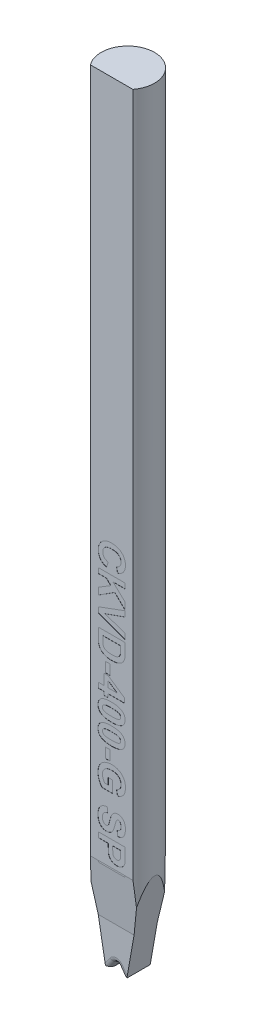
from build123d import *

# Parameters (mm, degrees)
SKETCH_TL_CUTTING_R       = 0.99695
TL_CUTTING_DEPTH          = 29.0068
SKETCH_TDF_GRINDING_W     = 2.0139
SKETCH_TDF_GRINDING_H     = 2.0139
TDF_GRINDING_DEPTH        = 30.041044486
SKETCH_ENGRAVING_W        = 0.166666667
SKETCH_ENGRAVING_H        = 0.371794872
SKETCH_ENGRAVING_W_2      = 1
SKETCH_ENGRAVING_H_2      = 0.192307693
ENGRAVING_DEPTH           = 0.005
VW_VR_GRINDING_DEPTH      = 1.00695
VW_VR_GRINDING_DEPTH_BACK = 1.00695
ISA_GRINDING_DEPTH        = 1.00695
ISA_GRINDING_DEPTH_BACK   = 1.00695
PRE_FRX_BRX_DEPTH         = 1.00695
PRE_FRX_BRX_DEPTH_BACK    = 1.00695
SKETCH_PRE_FRX_BRX_W      = 0.57134
SKETCH_PRE_FRX_BRX_H      = 1.524
FR_EDM_R                  = 0.20066
BR_EDM_R                  = 0.20066
FA_BA_GRINDING_DEPTH      = 1.00695
FA_BA_GRINDING_DEPTH_BACK = 1.00695


with BuildPart() as part:
    # sketch_TL_cutting → TL_cutting (new body)
    with BuildSketch(Plane(origin=(0, 0, 0), x_dir=(1, 0, 0), z_dir=(0, 1, 0))):
        Circle(SKETCH_TL_CUTTING_R)
    extrude(amount=TL_CUTTING_DEPTH)

    # sketch_TDF_grinding → TDF_grinding (cut, through all)
    with BuildSketch(Plane(origin=(0, 0, 0), x_dir=(1, 0, 0), z_dir=(0, 1, 0))):
        with Locations((0, -1.6102)):
            Rectangle(SKETCH_TDF_GRINDING_W, SKETCH_TDF_GRINDING_H)
    extrude(amount=TDF_GRINDING_DEPTH, mode=Mode.SUBTRACT)

    # sketch_engraving → engraving (cut)
    # profile 1 of 17: a face of its own
    with BuildSketch(Plane.XY.offset(0.60325)):
        with BuildLine():
            Line((-0.128205128, 13.263210256), (-0.192307692, 13.070902564))
            add(Edge.make_bspline(
                [(-0.192307692, 13.070902564), (-0.204917923, 13.074809052), (-0.229612721, 13.082459184), (-0.2649877, 13.096537804), (-0.297871332, 13.112532008), (-0.328259475, 13.130359875), (-0.356049464, 13.150095258), (-0.381471598, 13.171589244), (-0.404368127, 13.195053424), (-0.424673345, 13.220470624), (-0.442633936, 13.247563711), (-0.457816548, 13.276656053), (-0.470893242, 13.30731117), (-0.481488041, 13.339840557), (-0.489972889, 13.374028151), (-0.495577171, 13.410034413), (-0.499377062, 13.447690896), (-0.499789062, 13.473403283), (-0.5, 13.486567628)],
                knots=[0, 0, 0, 0, 1.126670901, 2.206376047, 3.246533763, 4.245677351, 5.210506282, 6.152793389, 7.083980095, 8.004497442, 8.926231833, 9.854395169, 10.801995143, 11.768203916, 12.771938831, 13.805609698, 14.87650608, 16, 16, 16, 16], degree=3))
            add(Edge.make_bspline(
                [(-0.5, 13.486567628), (-0.499663994, 13.502816309), (-0.499003061, 13.534777949), (-0.492350465, 13.581519052), (-0.481969511, 13.626060328), (-0.467601869, 13.668469613), (-0.448555271, 13.708448786), (-0.42571373, 13.746373108), (-0.398318662, 13.781809391), (-0.367249987, 13.814950716), (-0.332452821, 13.845079196), (-0.294134751, 13.871072297), (-0.253074131, 13.893610491), (-0.208709772, 13.911536594), (-0.161353037, 13.925621791), (-0.110975156, 13.935468328), (-0.057578507, 13.941634942), (-0.020984357, 13.942337083), (-0.002203526, 13.942697436)],
                knots=[0, 0, 0, 0, 1.025134988, 2.016471176, 2.973446247, 3.909197306, 4.836872559, 5.763618465, 6.698581235, 7.658772073, 8.627106982, 9.597494692, 10.576422683, 11.578339294, 12.6118974, 13.690673505, 14.814808564, 16, 16, 16, 16], degree=3))
            add(Edge.make_bspline(
                [(-0.002203526, 13.942697436), (0.017576475, 13.9423292), (0.056163648, 13.941610839), (0.112313555, 13.935562878), (0.165084042, 13.925516768), (0.214577853, 13.911940058), (0.260470573, 13.893729249), (0.303160692, 13.871873909), (0.342311169, 13.845756152), (0.377833814, 13.815831091), (0.409480853, 13.782697852), (0.437377469, 13.746993428), (0.460593243, 13.708491041), (0.479896446, 13.667667336), (0.494630503, 13.624223397), (0.505304611, 13.578276602), (0.511505561, 13.529806054), (0.512376199, 13.49666808), (0.512820513, 13.479756731)],
                knots=[0, 0, 0, 0, 1.212773307, 2.365899439, 3.458117515, 4.504331001, 5.50806732, 6.480562534, 7.440239902, 8.387651817, 9.323121479, 10.245404239, 11.160468186, 12.07454208, 13.009500751, 13.96802424, 14.963018902, 16, 16, 16, 16], degree=3))
            add(Edge.make_bspline(
                [(0.512820513, 13.479756731), (0.512448361, 13.464987276), (0.511718707, 13.436029796), (0.506761415, 13.393624506), (0.498061698, 13.353436158), (0.486319015, 13.315247521), (0.470821797, 13.279275987), (0.451884357, 13.245457111), (0.429606892, 13.213674651), (0.412205553, 13.194525065), (0.403445513, 13.184884936)],
                knots=[0, 0, 0, 0, 1.098510076, 2.153775193, 3.169777012, 4.153122333, 5.120892526, 6.076995459, 7.031936742, 8, 8, 8, 8], degree=3))
            add(Edge.make_bspline(
                [(0.403445513, 13.184884936), (0.39787141, 13.179297644), (0.386592274, 13.167991818), (0.367549896, 13.152895368), (0.347050772, 13.138582058), (0.324745215, 13.125279068), (0.30046466, 13.113406849), (0.274581981, 13.102394097), (0.246997406, 13.092255069), (0.227800247, 13.086616604), (0.217948718, 13.083723077)],
                knots=[0, 0, 0, 0, 0.885292881, 1.791380647, 2.722937556, 3.69093542, 4.703306561, 5.754477758, 6.847650944, 8, 8, 8, 8], degree=3))
            Line((0.217948718, 13.083723077), (0.179487179, 13.276030769))
            add(Edge.make_bspline(
                [(0.179487179, 13.276030769), (0.1857949, 13.277665288), (0.198219456, 13.280884861), (0.21607256, 13.28739955), (0.233014714, 13.294871208), (0.248625569, 13.3041361), (0.263619506, 13.313962074), (0.277222328, 13.325624773), (0.290109132, 13.338129754), (0.301694454, 13.352018861), (0.312145605, 13.366893589), (0.321339918, 13.382603983), (0.329014435, 13.399188478), (0.335156827, 13.416521754), (0.340319842, 13.434545702), (0.34350638, 13.453432147), (0.345953545, 13.473015752), (0.3460861, 13.486358875), (0.346153846, 13.493178205)],
                knots=[0, 0, 0, 0, 1.051114734, 2.070420253, 3.064047898, 4.034553068, 4.997066449, 5.953344811, 6.921213386, 7.892675544, 8.867420182, 9.852654213, 10.826683617, 11.811917648, 12.818610352, 13.848120519, 14.900229319, 16, 16, 16, 16], degree=3))
            add(Edge.make_bspline(
                [(0.346153846, 13.493178205), (0.345958725, 13.502542256), (0.345576529, 13.52088423), (0.341532101, 13.54761448), (0.335695112, 13.573055692), (0.326982094, 13.59711706), (0.315677399, 13.619731698), (0.302244603, 13.641228905), (0.286035184, 13.661060806), (0.26758257, 13.679699764), (0.246135655, 13.696407721), (0.221779967, 13.711110652), (0.194212535, 13.723304121), (0.163711493, 13.733204409), (0.130202077, 13.740996736), (0.093641969, 13.746561162), (0.054005962, 13.749638434), (0.026581025, 13.750133903), (0.012419872, 13.750389744)],
                knots=[0, 0, 0, 0, 0.93816214, 1.837638998, 2.704791736, 3.551915875, 4.396257554, 5.235807848, 6.087970119, 6.959042444, 7.860386085, 8.80649345, 9.804409709, 10.875695391, 12.017327537, 13.250155505, 14.580089023, 16, 16, 16, 16], degree=3))
            add(Edge.make_bspline(
                [(0.012419872, 13.750389744), (-0.002609028, 13.750136423), (-0.031567402, 13.749648312), (-0.073337178, 13.746571685), (-0.111754322, 13.740971705), (-0.14688701, 13.733282849), (-0.178713725, 13.723332973), (-0.207179389, 13.711159106), (-0.23231734, 13.696686701), (-0.254110839, 13.679938275), (-0.272831387, 13.661337256), (-0.288926796, 13.641387439), (-0.302688307, 13.620206524), (-0.314010391, 13.597667053), (-0.322575422, 13.573683298), (-0.328786932, 13.548452371), (-0.332735688, 13.521881695), (-0.333131326, 13.503675799), (-0.333333333, 13.494380128)],
                knots=[0, 0, 0, 0, 1.475208372, 2.842499301, 4.107722225, 5.282836115, 6.369007568, 7.375918121, 8.315702116, 9.208439171, 10.065831443, 10.90006451, 11.71996243, 12.54067204, 13.369972975, 14.214060185, 15.088124569, 16, 16, 16, 16], degree=3))
            add(Edge.make_bspline(
                [(-0.333333333, 13.494380128), (-0.333161634, 13.487497953), (-0.332824013, 13.473965176), (-0.330681155, 13.453962689), (-0.326591822, 13.43476438), (-0.321184418, 13.416276281), (-0.314399721, 13.398426559), (-0.305696319, 13.38148748), (-0.295693052, 13.365125777), (-0.283969989, 13.34968094), (-0.270808612, 13.334946156), (-0.255597341, 13.321507159), (-0.238701667, 13.309041373), (-0.220008678, 13.297706947), (-0.199678377, 13.28712516), (-0.177394008, 13.278122121), (-0.153515697, 13.269734984), (-0.136789345, 13.265423153), (-0.128205128, 13.263210256)],
                knots=[0, 0, 0, 0, 0.980177776, 1.927374078, 2.859849964, 3.771585772, 4.668674471, 5.574490016, 6.479656464, 7.396337719, 8.332153134, 9.288470092, 10.28125149, 11.318486971, 12.398724812, 13.541284404, 14.738150009, 16, 16, 16, 16], degree=3))
        make_face()
    # profile 2 of 17: a face of its own
    with BuildSketch(Plane.XY.offset(0.60325)):
        Polygon((-0.5, 12.904235897), (0.5, 12.904235897), (0.5, 12.711928205), (0.052283654, 12.711928205), (0.5, 12.290253526), (0.5, 12.026030769), (0.11338141, 12.405838462), (-0.5, 12.013210256), (-0.5, 12.269420192), (-0.035456731, 12.551671795), (-0.198517628, 12.711928205), (-0.5, 12.711928205), align=None)
    # profile 3 of 17: a face of its own
    with BuildSketch(Plane.XY.offset(0.60325)):
        Polygon((-0.5, 11.637008333), (0.5, 12.0068), (0.5, 11.803675), (-0.243589744, 11.538851282), (0.5, 11.275029167), (0.5, 11.070902564), (-0.5, 11.439291987), align=None)
    # profile 4 of 17: a face of its own
    with BuildSketch(Plane.XY.offset(0.60325)):
        with BuildLine():
            Line((0.5, 10.981158974), (0.5, 10.614372115))
            add(Edge.make_bspline(
                [(0.5, 10.614372115), (0.500005193, 10.604354571), (0.500015306, 10.584848084), (0.498840892, 10.556539066), (0.497659587, 10.530066494), (0.495294873, 10.505506352), (0.492816233, 10.482773432), (0.489678088, 10.461826942), (0.485656212, 10.442799202), (0.482484481, 10.430800319), (0.480969551, 10.425069231)],
                knots=[0, 0, 0, 0, 1.259756885, 2.453039283, 3.563158368, 4.591894114, 5.55549294, 6.43918076, 7.254497783, 8, 8, 8, 8], degree=3))
            add(Edge.make_bspline(
                [(0.480969551, 10.425069231), (0.478637325, 10.417900254), (0.474014881, 10.403691431), (0.465827813, 10.382838378), (0.455960096, 10.363004479), (0.445111978, 10.343729819), (0.432903728, 10.325457553), (0.419595761, 10.307742873), (0.404753223, 10.291109803), (0.383633179, 10.26957514), (0.35420815, 10.245150255), (0.315375005, 10.21931972), (0.272594656, 10.197582014), (0.234409605, 10.182390641), (0.20183843, 10.172346542), (0.175754603, 10.165778141), (0.148301213, 10.160106468), (0.119383738, 10.155856292), (0.08913491, 10.152194906), (0.057465542, 10.149567238), (0.024383276, 10.14826625), (0.001870575, 10.147974494), (-0.009615385, 10.147825641)],
                knots=[0, 0, 0, 0, 0.745431882, 1.477436776, 2.212739876, 2.934276521, 3.663147754, 4.384200836, 5.123377481, 5.865761747, 7.365547505, 8.894711587, 10.468722596, 12.101948761, 12.951987285, 13.837595333, 14.760899389, 15.722756883, 16.726861385, 17.773652936, 18.864119771, 20, 20, 20, 20], degree=3))
            add(Edge.make_bspline(
                [(-0.009615385, 10.147825641), (-0.0294616, 10.148217046), (-0.067834928, 10.14897384), (-0.123301552, 10.154571211), (-0.17465514, 10.163866648), (-0.206804138, 10.173577075), (-0.222355769, 10.178274359)],
                knots=[0, 0, 0, 0, 1.103491527, 2.133638164, 3.0971734, 4, 4, 4, 4], degree=3))
            add(Edge.make_bspline(
                [(-0.222355769, 10.178274359), (-0.231274521, 10.181448003), (-0.248819098, 10.187691057), (-0.274127236, 10.198615932), (-0.298211673, 10.210420337), (-0.321053432, 10.223202184), (-0.342549771, 10.237026052), (-0.362636394, 10.251943645), (-0.381577746, 10.267723731), (-0.393236239, 10.27915549), (-0.399038462, 10.284844872)],
                knots=[0, 0, 0, 0, 1.090884612, 2.145940218, 3.175104604, 4.181306866, 5.161203701, 6.118658341, 7.063689906, 8, 8, 8, 8], degree=3))
            add(Edge.make_bspline(
                [(-0.399038462, 10.284844872), (-0.407300305, 10.294131145), (-0.424264154, 10.313198431), (-0.445652736, 10.34654995), (-0.464086504, 10.384425276), (-0.473760833, 10.411739168), (-0.478766026, 10.425870513)],
                knots=[0, 0, 0, 0, 0.912008655, 1.872605891, 2.89935344, 4, 4, 4, 4], degree=3))
            add(Edge.make_bspline(
                [(-0.478766026, 10.425870513), (-0.4805228, 10.431590486), (-0.484168894, 10.443461996), (-0.488062998, 10.462285444), (-0.492165475, 10.482379947), (-0.49463687, 10.503977223), (-0.497243066, 10.526853081), (-0.498706299, 10.551189822), (-0.49974511, 10.576903081), (-0.499913777, 10.594539175), (-0.5, 10.603554808)],
                knots=[0, 0, 0, 0, 0.799129865, 1.658552685, 2.566799617, 3.538529252, 4.561352959, 5.643373779, 6.795284424, 8, 8, 8, 8], degree=3))
            Line((-0.5, 10.603554808), (-0.5, 10.981158974))
            Line((-0.5, 10.981158974), (0.5, 10.981158974))
        make_face()
        with BuildLine():
            Line((0.333333333, 10.788851282), (-0.333333333, 10.788851282))
            Line((-0.333333333, 10.788851282), (-0.333333333, 10.630598077))
            add(Edge.make_bspline(
                [(-0.333333333, 10.630598077), (-0.333276671, 10.62345336), (-0.333167574, 10.609697049), (-0.332847006, 10.589791316), (-0.331979167, 10.571498115), (-0.331080228, 10.554721614), (-0.329595022, 10.53950549), (-0.328134266, 10.525783535), (-0.326090699, 10.513632132), (-0.324477534, 10.506127127), (-0.323717949, 10.502593269)],
                knots=[0, 0, 0, 0, 1.333384787, 2.567275092, 3.714769766, 4.750907381, 5.701951617, 6.567520054, 7.325492842, 8, 8, 8, 8], degree=3))
            add(Edge.make_bspline(
                [(-0.323717949, 10.502593269), (-0.321509316, 10.494316575), (-0.317207482, 10.478195757), (-0.307617456, 10.455560499), (-0.296048139, 10.435078507), (-0.282136533, 10.41640677), (-0.26455548, 10.39957967), (-0.242070693, 10.385215683), (-0.215254411, 10.371922192), (-0.189584523, 10.362818806), (-0.16665678, 10.356284413), (-0.147412959, 10.351861165), (-0.126593091, 10.348365591), (-0.104279343, 10.345358942), (-0.080500412, 10.342929499), (-0.055170426, 10.341417784), (-0.028320392, 10.340386029), (-0.009883527, 10.340219161), (-0.000400641, 10.340133333)],
                knots=[0, 0, 0, 0, 1.038686998, 2.023088296, 2.974059649, 3.888265163, 4.839857954, 5.909819677, 7.113156087, 8.466843969, 9.20827164, 10.006482943, 10.861893492, 11.769681931, 12.739021491, 13.762258324, 14.849031541, 16, 16, 16, 16], degree=3))
            add(Edge.make_bspline(
                [(-0.000400641, 10.340133333), (0.009082275, 10.3402185), (0.027452469, 10.340383485), (0.054102292, 10.341413664), (0.079033415, 10.342916863), (0.102276578, 10.345363691), (0.123864169, 10.348323456), (0.143813574, 10.351860891), (0.161996804, 10.356254423), (0.183589283, 10.362807511), (0.207947697, 10.372644996), (0.23429421, 10.386471199), (0.2571147, 10.402736402), (0.276689574, 10.421091558), (0.29287817, 10.442178569), (0.306422028, 10.465549371), (0.316938162, 10.491680279), (0.321416742, 10.510269318), (0.323717949, 10.519820833)],
                knots=[0, 0, 0, 0, 1.118059345, 2.165891593, 3.144157881, 4.062285166, 4.920717571, 5.712910489, 6.449981617, 7.12489426, 8.371943983, 9.541298068, 10.624898781, 11.666293176, 12.69306237, 13.747704633, 14.842713931, 16, 16, 16, 16], degree=3))
            add(Edge.make_bspline(
                [(0.323717949, 10.519820833), (0.324486218, 10.523955143), (0.326177652, 10.533057311), (0.328151987, 10.548161571), (0.329628909, 10.565948179), (0.331099472, 10.586377116), (0.331977905, 10.609427064), (0.332859431, 10.635132571), (0.333166326, 10.663516851), (0.333276065, 10.683349207), (0.333333333, 10.693699038)],
                knots=[0, 0, 0, 0, 0.578739524, 1.274162912, 2.095457587, 3.035141998, 4.093102578, 5.270121571, 6.575369351, 8, 8, 8, 8], degree=3))
            Line((0.333333333, 10.693699038), (0.333333333, 10.788851282))
        make_face(mode=Mode.SUBTRACT)
    # profile 5 of 17: a face of its own
    with BuildSketch(Plane.XY.offset(0.60325)):
        with Locations((-0.147435898, 9.820902564)):
            Rectangle(SKETCH_ENGRAVING_W, SKETCH_ENGRAVING_H)
    # profile 6 of 17: a face of its own
    with BuildSketch(Plane.XY.offset(0.60325)):
        Polygon((-0.5, 9.199107692), (-0.294871795, 9.199107692), (-0.294871795, 9.59654359), (-0.12880609, 9.59654359), (0.487179487, 9.173666987), (0.487179487, 9.0068), (-0.128205128, 9.0068), (-0.128205128, 8.878594872), (-0.294871795, 8.878594872), (-0.294871795, 9.0068), (-0.5, 9.0068), align=None)
        Polygon((-0.128205128, 9.199107692), (0.204727564, 9.199107692), (-0.128205128, 9.427873718), align=None, mode=Mode.SUBTRACT)
    # profile 7 of 17: a face of its own
    with BuildSketch(Plane.XY.offset(0.60325)):
        with BuildLine():
            add(Edge.make_bspline(
                [(0.5, 8.474748718), (0.49971384, 8.462844998), (0.499156721, 8.439669821), (0.494192381, 8.405907508), (0.486315205, 8.374154925), (0.474936732, 8.344405943), (0.460535804, 8.316509267), (0.442472771, 8.290857415), (0.421624591, 8.26685643), (0.405435577, 8.253000797), (0.397235577, 8.245982692)],
                knots=[0, 0, 0, 0, 1.098626248, 2.138899374, 3.143835643, 4.113754749, 5.073488057, 6.034745239, 7.004566348, 8, 8, 8, 8], degree=3))
            add(Edge.make_bspline(
                [(0.397235577, 8.245982692), (0.392013767, 8.241967993), (0.381356969, 8.233774695), (0.364136726, 8.22274029), (0.345869985, 8.212131685), (0.326116385, 8.202873442), (0.305221356, 8.194000078), (0.283126793, 8.185809313), (0.259707844, 8.17857695), (0.235071142, 8.172272124), (0.209179241, 8.166378627), (0.181968999, 8.161441398), (0.15350924, 8.157215972), (0.123831018, 8.153920738), (0.092992495, 8.150966339), (0.060842825, 8.149349757), (0.027454838, 8.148025267), (0.004742429, 8.147892949), (-0.006810897, 8.147825641)],
                knots=[0, 0, 0, 0, 0.746775751, 1.524038446, 2.317840886, 3.141016509, 3.996283186, 4.892488336, 5.812382473, 6.774967264, 7.776368117, 8.823659909, 9.910833035, 11.039122168, 12.210293276, 13.424012874, 14.68964937, 16, 16, 16, 16], degree=3))
            add(Edge.make_bspline(
                [(-0.006810897, 8.147825641), (-0.01836425, 8.147891934), (-0.041009977, 8.148021876), (-0.074330982, 8.149354693), (-0.106413621, 8.150967781), (-0.13725379, 8.153913853), (-0.166926114, 8.157240728), (-0.195353975, 8.161346272), (-0.22243919, 8.166664764), (-0.248289812, 8.172471418), (-0.27303117, 8.178736077), (-0.296407841, 8.1862899), (-0.318777777, 8.194150303), (-0.339699687, 8.203229898), (-0.359477735, 8.212820372), (-0.377930928, 8.223271112), (-0.395257891, 8.234428726), (-0.40597091, 8.242701289), (-0.411258013, 8.246783974)],
                knots=[0, 0, 0, 0, 1.308411734, 2.564617834, 3.776541518, 4.94597967, 6.0725993, 7.15816376, 8.197872509, 9.197791611, 10.158952087, 11.086962723, 11.979249638, 12.843171697, 13.668427753, 14.467630577, 15.243743175, 16, 16, 16, 16], degree=3))
            add(Edge.make_bspline(
                [(-0.411258013, 8.246783974), (-0.419387722, 8.253737875), (-0.435436162, 8.267465209), (-0.456111536, 8.291200465), (-0.473801555, 8.3168109), (-0.487914093, 8.344657064), (-0.499368982, 8.374261236), (-0.506993451, 8.406065546), (-0.511967929, 8.439735616), (-0.512532265, 8.462911213), (-0.512820513, 8.474748718)],
                knots=[0, 0, 0, 0, 0.991667276, 1.957599061, 2.911530233, 3.873218945, 4.847995157, 5.850445929, 6.902062539, 8, 8, 8, 8], degree=3))
            add(Edge.make_bspline(
                [(-0.512820513, 8.474748718), (-0.512476011, 8.486721133), (-0.511800941, 8.510181702), (-0.506449472, 8.544435149), (-0.497876451, 8.576994622), (-0.485636462, 8.607743234), (-0.469774335, 8.636636989), (-0.45076002, 8.663901616), (-0.427732542, 8.688943948), (-0.40629523, 8.708549361), (-0.386925042, 8.722892741), (-0.37086259, 8.733009036), (-0.353675124, 8.742785358), (-0.33482528, 8.751223499), (-0.314870578, 8.759548475), (-0.293380967, 8.766921787), (-0.270541238, 8.773426959), (-0.246455682, 8.779534901), (-0.220958398, 8.784628025), (-0.194124629, 8.789312952), (-0.165840258, 8.793004927), (-0.136262825, 8.796278243), (-0.105322509, 8.798582844), (-0.073069943, 8.800454475), (-0.039401887, 8.801392969), (-0.01649349, 8.801577608), (-0.004807692, 8.801671795)],
                knots=[0, 0, 0, 0, 1.257818097, 2.464759732, 3.634271214, 4.790227596, 5.933394726, 7.09190477, 8.274482889, 9.50191983, 10.139172818, 10.805000628, 11.49619854, 12.215266328, 12.973768034, 13.768328009, 14.601232062, 15.469317089, 16.379095881, 17.333267023, 18.331755967, 19.376479622, 20.460535752, 21.592206075, 22.771760786, 24, 24, 24, 24], degree=3))
            add(Edge.make_bspline(
                [(-0.004807692, 8.801671795), (0.006678925, 8.801606), (0.02919122, 8.801477052), (0.062378132, 8.800134948), (0.094328674, 8.798541634), (0.12509981, 8.79556902), (0.154640959, 8.792269515), (0.183004063, 8.788156894), (0.209982531, 8.782738814), (0.235876189, 8.777389743), (0.260431507, 8.770649782), (0.2837906, 8.763224475), (0.306110518, 8.755390136), (0.326924245, 8.746217854), (0.346659803, 8.736682898), (0.365109758, 8.726224838), (0.382437536, 8.715069066), (0.39315045, 8.706796265), (0.3984375, 8.702713462)],
                knots=[0, 0, 0, 0, 1.304443357, 2.556541329, 3.771813033, 4.936929721, 6.066661712, 7.147723817, 8.190304831, 9.191350322, 10.149780912, 11.080355239, 11.975107155, 12.834450748, 13.66198663, 14.463397305, 15.241653965, 16, 16, 16, 16], degree=3))
            add(Edge.make_bspline(
                [(0.3984375, 8.702713462), (0.406566428, 8.695759179), (0.422613323, 8.682031089), (0.443299998, 8.658301361), (0.460913987, 8.632719209), (0.475197493, 8.604954301), (0.486497465, 8.575282107), (0.494183265, 8.543436121), (0.499144648, 8.509760686), (0.499710816, 8.486585839), (0.5, 8.474748718)],
                knots=[0, 0, 0, 0, 0.991631672, 1.957528776, 2.911425699, 3.867574088, 4.848108326, 5.850523106, 6.902101959, 8, 8, 8, 8], degree=3))
        make_face()
        with BuildLine():
            add(Edge.make_bspline(
                [(0.333333333, 8.474748718), (0.333068079, 8.480916684), (0.332548986, 8.492987158), (0.328316127, 8.510542094), (0.321759633, 8.527123165), (0.312130705, 8.542681206), (0.299093083, 8.55708978), (0.281476094, 8.569297658), (0.259881539, 8.579851162), (0.243736, 8.585130771), (0.235176282, 8.587929808)],
                knots=[0, 0, 0, 0, 0.909107913, 1.77908945, 2.650019014, 3.530482969, 4.465025013, 5.495890128, 6.672421267, 8, 8, 8, 8], degree=3))
            add(Edge.make_bspline(
                [(0.235176282, 8.587929808), (0.228718042, 8.589677997), (0.214837576, 8.593435317), (0.192206647, 8.59769972), (0.166522939, 8.601216485), (0.137792419, 8.604186038), (0.105999886, 8.606602628), (0.071125109, 8.608090848), (0.033192525, 8.609119478), (0.006878451, 8.609280391), (-0.006810897, 8.609364103)],
                knots=[0, 0, 0, 0, 0.658986521, 1.416336438, 2.266694271, 3.212608458, 4.261595115, 5.407496572, 6.651304179, 8, 8, 8, 8], degree=3))
            add(Edge.make_bspline(
                [(-0.006810897, 8.609364103), (-0.020433943, 8.609373117), (-0.046549094, 8.609390397), (-0.084006477, 8.608216163), (-0.118154033, 8.60704872), (-0.148991056, 8.604679061), (-0.176626244, 8.602340892), (-0.200847568, 8.598803343), (-0.221857789, 8.595250608), (-0.244486895, 8.589217153), (-0.268257705, 8.580901394), (-0.292448985, 8.569672977), (-0.311537375, 8.557007058), (-0.325415776, 8.542475587), (-0.334597404, 8.526730329), (-0.341538269, 8.510426395), (-0.345246665, 8.492874555), (-0.345848983, 8.480840013), (-0.346153846, 8.474748718)],
                knots=[0, 0, 0, 0, 1.613038927, 3.092168624, 4.43749063, 5.658264602, 6.75425577, 7.720394221, 8.556328411, 9.275513998, 10.490872946, 11.534172084, 12.42681833, 13.187531851, 13.88996177, 14.574222125, 15.278341114, 16, 16, 16, 16], degree=3))
            add(Edge.make_bspline(
                [(-0.346153846, 8.474748718), (-0.345874419, 8.46865088), (-0.345321688, 8.456588799), (-0.341225408, 8.439056833), (-0.334465655, 8.422499336), (-0.325029126, 8.406836493), (-0.311901617, 8.39241441), (-0.294300445, 8.380197614), (-0.272700888, 8.36964693), (-0.25655611, 8.364366893), (-0.247996795, 8.361567628)],
                knots=[0, 0, 0, 0, 0.899391665, 1.779078861, 2.640979247, 3.529945348, 4.464599804, 5.495588918, 6.672261578, 8, 8, 8, 8], degree=3))
            add(Edge.make_bspline(
                [(-0.247996795, 8.361567628), (-0.241538043, 8.359821968), (-0.227719754, 8.356087186), (-0.205229709, 8.351792396), (-0.179679092, 8.34826611), (-0.151079269, 8.345324791), (-0.11935541, 8.342884431), (-0.084546407, 8.341408845), (-0.046680798, 8.340379247), (-0.020433482, 8.340217356), (-0.006810897, 8.340133333)],
                knots=[0, 0, 0, 0, 0.66114423, 1.414496391, 2.261103113, 3.210114492, 4.255954433, 5.405607896, 6.653488082, 8, 8, 8, 8], degree=3))
            add(Edge.make_bspline(
                [(-0.006810897, 8.340133333), (0.006810741, 8.340247109), (0.032921137, 8.340465199), (0.070464093, 8.341092091), (0.104645163, 8.342847006), (0.13553417, 8.344603226), (0.163028833, 8.347568631), (0.187277888, 8.350511537), (0.208178651, 8.354583667), (0.23096624, 8.360175697), (0.254848985, 8.36851368), (0.278913284, 8.38008584), (0.298191428, 8.39252291), (0.312146257, 8.407029879), (0.321683592, 8.422748044), (0.328364426, 8.439200374), (0.332523972, 8.456649531), (0.333060584, 8.46864941), (0.333333333, 8.474748718)],
                knots=[0, 0, 0, 0, 1.611458614, 3.088895909, 4.441089836, 5.660086535, 6.747875232, 7.711965119, 8.548505902, 9.26500436, 10.486583113, 11.532259092, 12.419544583, 13.184925779, 13.890764661, 14.581638641, 15.279074115, 16, 16, 16, 16], degree=3))
        make_face(mode=Mode.SUBTRACT)
    # profile 8 of 17: a face of its own
    with BuildSketch(Plane.XY.offset(0.60325)):
        with BuildLine():
            add(Edge.make_bspline(
                [(0.5, 7.705517949), (0.49971384, 7.693614229), (0.499156721, 7.670439051), (0.494192381, 7.636676739), (0.486315205, 7.604924156), (0.474936732, 7.575175173), (0.460535804, 7.547278497), (0.442472771, 7.521626646), (0.421624591, 7.497625661), (0.405435577, 7.483770028), (0.397235577, 7.476751923)],
                knots=[0, 0, 0, 0, 1.098626248, 2.138899374, 3.143835643, 4.113754749, 5.073488057, 6.034745239, 7.004566348, 8, 8, 8, 8], degree=3))
            add(Edge.make_bspline(
                [(0.397235577, 7.476751923), (0.392013767, 7.472737224), (0.381356969, 7.464543926), (0.364136726, 7.45350952), (0.345869985, 7.442900915), (0.326116385, 7.433642673), (0.305221356, 7.424769309), (0.283126793, 7.416578544), (0.259707844, 7.40934618), (0.235071142, 7.403041354), (0.209179241, 7.397147858), (0.181968999, 7.392210628), (0.15350924, 7.387985203), (0.123831018, 7.384689969), (0.092992495, 7.38173557), (0.060842825, 7.380118988), (0.027454838, 7.378794498), (0.004742429, 7.378662179), (-0.006810897, 7.378594872)],
                knots=[0, 0, 0, 0, 0.746775751, 1.524038446, 2.317840886, 3.141016509, 3.996283186, 4.892488336, 5.812382473, 6.774967264, 7.776368117, 8.823659909, 9.910833035, 11.039122168, 12.210293276, 13.424012874, 14.68964937, 16, 16, 16, 16], degree=3))
            add(Edge.make_bspline(
                [(-0.006810897, 7.378594872), (-0.01836425, 7.378661165), (-0.041009977, 7.378791107), (-0.074330982, 7.380123924), (-0.106413621, 7.381737012), (-0.13725379, 7.384683084), (-0.166926114, 7.388009959), (-0.195353975, 7.392115503), (-0.22243919, 7.397433995), (-0.248289812, 7.403240649), (-0.27303117, 7.409505308), (-0.296407841, 7.417059131), (-0.318777777, 7.424919533), (-0.339699687, 7.433999129), (-0.359477735, 7.443589602), (-0.377930928, 7.454040342), (-0.395257891, 7.465197957), (-0.40597091, 7.47347052), (-0.411258013, 7.477553205)],
                knots=[0, 0, 0, 0, 1.308411734, 2.564617834, 3.776541518, 4.94597967, 6.0725993, 7.15816376, 8.197872509, 9.197791611, 10.158952087, 11.086962723, 11.979249638, 12.843171697, 13.668427753, 14.467630577, 15.243743175, 16, 16, 16, 16], degree=3))
            add(Edge.make_bspline(
                [(-0.411258013, 7.477553205), (-0.419387722, 7.484507105), (-0.435436162, 7.49823444), (-0.456111536, 7.521969695), (-0.473801555, 7.547580131), (-0.487914093, 7.575426295), (-0.499368982, 7.605030467), (-0.506993451, 7.636834777), (-0.511967929, 7.670504847), (-0.512532265, 7.693680444), (-0.512820513, 7.705517949)],
                knots=[0, 0, 0, 0, 0.991667276, 1.957599061, 2.911530233, 3.873218945, 4.847995157, 5.850445929, 6.902062539, 8, 8, 8, 8], degree=3))
            add(Edge.make_bspline(
                [(-0.512820513, 7.705517949), (-0.512476011, 7.717490364), (-0.511800941, 7.740950933), (-0.506449472, 7.775204379), (-0.497876451, 7.807763853), (-0.485636462, 7.838512465), (-0.469774335, 7.86740622), (-0.45076002, 7.894670847), (-0.427732542, 7.919713179), (-0.40629523, 7.939318592), (-0.386925042, 7.953661971), (-0.37086259, 7.963778267), (-0.353675124, 7.973554589), (-0.33482528, 7.98199273), (-0.314870578, 7.990317706), (-0.293380967, 7.997691018), (-0.270541238, 8.00419619), (-0.246455682, 8.010304132), (-0.220958398, 8.015397256), (-0.194124629, 8.020082183), (-0.165840258, 8.023774157), (-0.136262825, 8.027047473), (-0.105322509, 8.029352075), (-0.073069943, 8.031223706), (-0.039401887, 8.0321622), (-0.01649349, 8.032346839), (-0.004807692, 8.032441026)],
                knots=[0, 0, 0, 0, 1.257818097, 2.464759732, 3.634271214, 4.790227596, 5.933394726, 7.09190477, 8.274482889, 9.50191983, 10.139172818, 10.805000628, 11.49619854, 12.215266328, 12.973768034, 13.768328009, 14.601232062, 15.469317089, 16.379095881, 17.333267023, 18.331755967, 19.376479622, 20.460535752, 21.592206075, 22.771760786, 24, 24, 24, 24], degree=3))
            add(Edge.make_bspline(
                [(-0.004807692, 8.032441026), (0.006678925, 8.032375231), (0.02919122, 8.032246282), (0.062378132, 8.030904179), (0.094328674, 8.029310865), (0.12509981, 8.026338251), (0.154640959, 8.023038746), (0.183004063, 8.018926125), (0.209982531, 8.013508045), (0.235876189, 8.008158974), (0.260431507, 8.001419013), (0.2837906, 7.993993706), (0.306110518, 7.986159367), (0.326924245, 7.976987084), (0.346659803, 7.967452128), (0.365109758, 7.956994069), (0.382437536, 7.945838297), (0.39315045, 7.937565495), (0.3984375, 7.933482692)],
                knots=[0, 0, 0, 0, 1.304443357, 2.556541329, 3.771813033, 4.936929721, 6.066661712, 7.147723817, 8.190304831, 9.191350322, 10.149780912, 11.080355239, 11.975107155, 12.834450748, 13.66198663, 14.463397305, 15.241653965, 16, 16, 16, 16], degree=3))
            add(Edge.make_bspline(
                [(0.3984375, 7.933482692), (0.406566428, 7.92652841), (0.422613323, 7.91280032), (0.443299998, 7.889070592), (0.460913987, 7.863488439), (0.475197493, 7.835723532), (0.486497465, 7.806051338), (0.494183265, 7.774205352), (0.499144648, 7.740529916), (0.499710816, 7.71735507), (0.5, 7.705517949)],
                knots=[0, 0, 0, 0, 0.991631672, 1.957528776, 2.911425699, 3.867574088, 4.848108326, 5.850523106, 6.902101959, 8, 8, 8, 8], degree=3))
        make_face()
        with BuildLine():
            add(Edge.make_bspline(
                [(0.333333333, 7.705517949), (0.333068079, 7.711685915), (0.332548986, 7.723756389), (0.328316127, 7.741311325), (0.321759633, 7.757892396), (0.312130705, 7.773450436), (0.299093083, 7.787859011), (0.281476094, 7.800066888), (0.259881539, 7.810620392), (0.243736, 7.815900001), (0.235176282, 7.818699038)],
                knots=[0, 0, 0, 0, 0.909107913, 1.77908945, 2.650019014, 3.530482969, 4.465025013, 5.495890128, 6.672421267, 8, 8, 8, 8], degree=3))
            add(Edge.make_bspline(
                [(0.235176282, 7.818699038), (0.228718042, 7.820447227), (0.214837576, 7.824204548), (0.192206647, 7.828468951), (0.166522939, 7.831985716), (0.137792419, 7.834955269), (0.105999886, 7.837371859), (0.071125109, 7.838860078), (0.033192525, 7.839888709), (0.006878451, 7.840049622), (-0.006810897, 7.840133333)],
                knots=[0, 0, 0, 0, 0.658986521, 1.416336438, 2.266694271, 3.212608458, 4.261595115, 5.407496572, 6.651304179, 8, 8, 8, 8], degree=3))
            add(Edge.make_bspline(
                [(-0.006810897, 7.840133333), (-0.020433943, 7.840142347), (-0.046549094, 7.840159627), (-0.084006477, 7.838985394), (-0.118154033, 7.837817951), (-0.148991056, 7.835448292), (-0.176626244, 7.833110123), (-0.200847568, 7.829572574), (-0.221857789, 7.826019839), (-0.244486895, 7.819986384), (-0.268257705, 7.811670625), (-0.292448985, 7.800442207), (-0.311537375, 7.787776289), (-0.325415776, 7.773244818), (-0.334597404, 7.75749956), (-0.341538269, 7.741195625), (-0.345246665, 7.723643786), (-0.345848983, 7.711609244), (-0.346153846, 7.705517949)],
                knots=[0, 0, 0, 0, 1.613038927, 3.092168624, 4.43749063, 5.658264602, 6.75425577, 7.720394221, 8.556328411, 9.275513998, 10.490872946, 11.534172084, 12.42681833, 13.187531851, 13.88996177, 14.574222125, 15.278341114, 16, 16, 16, 16], degree=3))
            add(Edge.make_bspline(
                [(-0.346153846, 7.705517949), (-0.345874419, 7.699420111), (-0.345321688, 7.68735803), (-0.341225408, 7.669826063), (-0.334465655, 7.653268567), (-0.325029126, 7.637605723), (-0.311901617, 7.623183641), (-0.294300445, 7.610966845), (-0.272700888, 7.600416161), (-0.25655611, 7.595136123), (-0.247996795, 7.592336859)],
                knots=[0, 0, 0, 0, 0.899391665, 1.779078861, 2.640979247, 3.529945348, 4.464599804, 5.495588918, 6.672261578, 8, 8, 8, 8], degree=3))
            add(Edge.make_bspline(
                [(-0.247996795, 7.592336859), (-0.241538043, 7.590591199), (-0.227719754, 7.586856417), (-0.205229709, 7.582561627), (-0.179679092, 7.57903534), (-0.151079269, 7.576094022), (-0.11935541, 7.573653662), (-0.084546407, 7.572178076), (-0.046680798, 7.571148478), (-0.020433482, 7.570986587), (-0.006810897, 7.570902564)],
                knots=[0, 0, 0, 0, 0.66114423, 1.414496391, 2.261103113, 3.210114492, 4.255954433, 5.405607896, 6.653488082, 8, 8, 8, 8], degree=3))
            add(Edge.make_bspline(
                [(-0.006810897, 7.570902564), (0.006810741, 7.57101634), (0.032921137, 7.57123443), (0.070464093, 7.571861322), (0.104645163, 7.573616237), (0.13553417, 7.575372457), (0.163028833, 7.578337861), (0.187277888, 7.581280768), (0.208178651, 7.585352897), (0.23096624, 7.590944928), (0.254848985, 7.59928291), (0.278913284, 7.610855071), (0.298191428, 7.623292141), (0.312146257, 7.63779911), (0.321683592, 7.653517274), (0.328364426, 7.669969605), (0.332523972, 7.687418762), (0.333060584, 7.699418641), (0.333333333, 7.705517949)],
                knots=[0, 0, 0, 0, 1.611458614, 3.088895909, 4.441089836, 5.660086535, 6.747875232, 7.711965119, 8.548505902, 9.26500436, 10.486583113, 11.532259092, 12.419544583, 13.184925779, 13.890764661, 14.581638641, 15.279074115, 16, 16, 16, 16], degree=3))
        make_face(mode=Mode.SUBTRACT)
    # profile 9 of 17: a face of its own
    with BuildSketch(Plane.XY.offset(0.60325)):
        with Locations((-0.147435898, 7.051671795)):
            Rectangle(SKETCH_ENGRAVING_W, SKETCH_ENGRAVING_H)
    # profile 10 of 17: a face of its own
    with BuildSketch(Plane.XY.offset(0.60325)):
        with BuildLine():
            Line((-0.128205128, 6.301671795), (0.038461538, 6.301671795))
            Line((0.038461538, 6.301671795), (0.038461538, 5.865774359))
            Line((0.038461538, 5.865774359), (-0.36338141, 5.865774359))
            add(Edge.make_bspline(
                [(-0.36338141, 5.865774359), (-0.368321434, 5.871260375), (-0.378419843, 5.8824749), (-0.392661125, 5.900772664), (-0.406257259, 5.920916779), (-0.4194836, 5.942785469), (-0.432233696, 5.966423992), (-0.444685123, 5.991738064), (-0.45671611, 6.018774391), (-0.471787381, 6.057007711), (-0.488186169, 6.10622183), (-0.502445448, 6.166387076), (-0.511191227, 6.227028267), (-0.512277771, 6.267589075), (-0.512820513, 6.287849679)],
                knots=[0, 0, 0, 0, 0.581799769, 1.189316438, 1.825828404, 2.496525428, 3.203088405, 3.942228803, 4.719818701, 5.534979611, 7.181138583, 8.803804008, 10.403462225, 12, 12, 12, 12], degree=3))
            add(Edge.make_bspline(
                [(-0.512820513, 6.287849679), (-0.512629241, 6.300542166), (-0.512252188, 6.325562831), (-0.509233571, 6.362501118), (-0.504017902, 6.398218224), (-0.496780719, 6.432650736), (-0.487836372, 6.465901646), (-0.476607913, 6.497854166), (-0.463065488, 6.528474068), (-0.447986133, 6.557990581), (-0.430657849, 6.585843177), (-0.411724289, 6.612087023), (-0.390891397, 6.636467404), (-0.36853351, 6.659196217), (-0.344060025, 6.679844803), (-0.318106216, 6.698926641), (-0.290219674, 6.715985038), (-0.260879177, 6.731311559), (-0.230317098, 6.744940942), (-0.198781008, 6.756443246), (-0.166726875, 6.766526922), (-0.134042675, 6.774814707), (-0.10062201, 6.780901654), (-0.066619552, 6.785633529), (-0.031822841, 6.788175004), (-0.008417054, 6.788624325), (0.003405449, 6.788851282)],
                knots=[0, 0, 0, 0, 1.124897971, 2.217508473, 3.282174662, 4.322209414, 5.334422951, 6.332119154, 7.320662553, 8.300074908, 9.267468154, 10.225199689, 11.165658754, 12.107290334, 13.047749399, 14.00069605, 14.959944213, 15.942088746, 16.933021067, 17.923599838, 18.915715637, 19.910475908, 20.909926025, 21.925232038, 22.952013513, 24, 24, 24, 24], degree=3))
            add(Edge.make_bspline(
                [(0.003405449, 6.788851282), (0.016165747, 6.788667383), (0.041321811, 6.788304838), (0.078501182, 6.785175194), (0.114594914, 6.780327239), (0.149519517, 6.772932247), (0.183523729, 6.764078796), (0.216299841, 6.752734109), (0.248180515, 6.739780661), (0.278688999, 6.724496543), (0.308028284, 6.707613971), (0.335510174, 6.6884304), (0.361403632, 6.6676108), (0.385591047, 6.644967968), (0.407627145, 6.620129007), (0.428063784, 6.593603308), (0.447146094, 6.56540846), (0.457908016, 6.545231736), (0.463341346, 6.535045192)],
                knots=[0, 0, 0, 0, 1.105132952, 2.178694671, 3.229818344, 4.257558797, 5.269123684, 6.27148554, 7.259679084, 8.247804916, 9.224967877, 10.189258471, 11.147685264, 12.101072275, 13.055511435, 14.02039165, 15.000562851, 16, 16, 16, 16], degree=3))
            add(Edge.make_bspline(
                [(0.463341346, 6.535045192), (0.467347168, 6.526957841), (0.475455657, 6.510587618), (0.485329628, 6.484514525), (0.494054347, 6.457146948), (0.500719187, 6.428165473), (0.506115234, 6.397878993), (0.510216979, 6.366137917), (0.512307439, 6.332883708), (0.512647258, 6.310221284), (0.512820513, 6.298666987)],
                knots=[0, 0, 0, 0, 0.887950456, 1.797368171, 2.741221183, 3.713797788, 4.722103116, 5.768966405, 6.862521341, 8, 8, 8, 8], degree=3))
            add(Edge.make_bspline(
                [(0.512820513, 6.298666987), (0.512598613, 6.283769487), (0.512167059, 6.254796604), (0.508571106, 6.21255631), (0.502373597, 6.172802674), (0.493837942, 6.135480334), (0.482863355, 6.100669697), (0.469371425, 6.068430687), (0.453633675, 6.038565429), (0.435019378, 6.011506485), (0.414494937, 5.986703918), (0.392035387, 5.964222449), (0.367607461, 5.944053031), (0.341334074, 5.926182318), (0.313106625, 5.910750967), (0.283182558, 5.897482952), (0.251334696, 5.886561769), (0.22921692, 5.881283803), (0.217948718, 5.878594872)],
                knots=[0, 0, 0, 0, 1.271135529, 2.472123572, 3.614091059, 4.701890498, 5.736279567, 6.724681829, 7.680621489, 8.611506429, 9.52200816, 10.424540711, 11.318996785, 12.221421405, 13.131851814, 14.060431888, 15.011860567, 16, 16, 16, 16], degree=3))
            Line((0.217948718, 5.878594872), (0.179487179, 6.070902564))
            add(Edge.make_bspline(
                [(0.179487179, 6.070902564), (0.185798707, 6.072805146), (0.198251232, 6.076558905), (0.216108293, 6.083865481), (0.232994438, 6.092183603), (0.248643132, 6.102010597), (0.263649233, 6.112448251), (0.277161531, 6.124718435), (0.290187329, 6.137625453), (0.301701762, 6.152116609), (0.312086782, 6.167555164), (0.321450083, 6.183776632), (0.329043783, 6.201144974), (0.335153652, 6.219417597), (0.340342569, 6.238505002), (0.343533767, 6.25865634), (0.345940549, 6.2796453), (0.346081986, 6.293985325), (0.346153846, 6.301271154)],
                knots=[0, 0, 0, 0, 1.027780279, 2.027791312, 3.006028774, 3.96000864, 4.908113241, 5.852721087, 6.802883308, 7.765918715, 8.733730415, 9.704005314, 10.683351261, 11.68471758, 12.707948499, 13.764514378, 14.864202456, 16, 16, 16, 16], degree=3))
            add(Edge.make_bspline(
                [(0.346153846, 6.301271154), (0.345859633, 6.312298511), (0.34528545, 6.333819337), (0.341538784, 6.365236876), (0.334873123, 6.394876442), (0.325679114, 6.42281554), (0.313877959, 6.449105391), (0.299029501, 6.473390737), (0.282012344, 6.49627627), (0.262039987, 6.517110747), (0.239645267, 6.53600525), (0.214561065, 6.552361822), (0.186868462, 6.565978599), (0.156706511, 6.577131515), (0.124073954, 6.586011616), (0.088855272, 6.592035764), (0.051104495, 6.595971833), (0.02505068, 6.596349093), (0.01161859, 6.59654359)],
                knots=[0, 0, 0, 0, 1.043810997, 2.037086103, 2.989314757, 3.91471467, 4.817033861, 5.710208705, 6.603920097, 7.511448416, 8.435617211, 9.371747005, 10.338444094, 11.350425613, 12.411431869, 13.5347293, 14.729025275, 16, 16, 16, 16], degree=3))
            add(Edge.make_bspline(
                [(0.01161859, 6.59654359), (-0.002813331, 6.596340916), (-0.03086261, 6.595947007), (-0.071503034, 6.592112106), (-0.109371212, 6.585813885), (-0.14440027, 6.576746527), (-0.176807311, 6.565439264), (-0.206438048, 6.551459735), (-0.233109204, 6.534651899), (-0.256980675, 6.515589064), (-0.278169336, 6.494552253), (-0.296147735, 6.471489293), (-0.31184176, 6.447231086), (-0.32420794, 6.421091286), (-0.33413508, 6.393542798), (-0.341078682, 6.364316769), (-0.345395871, 6.333518498), (-0.345897627, 6.312436945), (-0.346153846, 6.301671795)],
                knots=[0, 0, 0, 0, 1.31821493, 2.562027667, 3.72541598, 4.821825939, 5.863743127, 6.857000185, 7.808227391, 8.737146514, 9.643023621, 10.529087527, 11.404035307, 12.277173472, 13.164790074, 14.074766194, 15.016892606, 16, 16, 16, 16], degree=3))
            add(Edge.make_bspline(
                [(-0.346153846, 6.301671795), (-0.345850315, 6.290768504), (-0.34524035, 6.268857617), (-0.340086045, 6.236036537), (-0.332449955, 6.203036283), (-0.321065283, 6.170643933), (-0.307937779, 6.139257225), (-0.292687307, 6.110091024), (-0.276962331, 6.082698447), (-0.264654274, 6.066185969), (-0.258613782, 6.058082051)],
                knots=[0, 0, 0, 0, 0.993779204, 1.997065276, 3.023588959, 4.078879359, 5.123947549, 6.123456565, 7.079038607, 8, 8, 8, 8], degree=3))
            Line((-0.258613782, 6.058082051), (-0.128205128, 6.058082051))
            Line((-0.128205128, 6.058082051), (-0.128205128, 6.301671795))
        make_face()
    # profile 11 of 17: a face of its own
    with BuildSketch(Plane.XY.offset(0.60325)):
        with BuildLine():
            Line((-0.166666667, 5.340133333), (-0.153846154, 5.147825641))
            add(Edge.make_bspline(
                [(-0.153846154, 5.147825641), (-0.161891279, 5.146292992), (-0.177518424, 5.143315918), (-0.199795017, 5.136712009), (-0.220541784, 5.129405841), (-0.239662803, 5.120792964), (-0.25710555, 5.110927896), (-0.273156714, 5.100137618), (-0.28732832, 5.087894862), (-0.299925293, 5.074563176), (-0.310783278, 5.059989999), (-0.320246275, 5.044289399), (-0.328256178, 5.027368131), (-0.334922245, 5.009290819), (-0.339885492, 4.989877406), (-0.343420115, 4.969309762), (-0.345682646, 4.947554761), (-0.345994208, 4.932687096), (-0.346153846, 4.925069231)],
                knots=[0, 0, 0, 0, 1.20477517, 2.340199137, 3.415898527, 4.440826703, 5.422227366, 6.362763262, 7.28278988, 8.172822029, 9.057410505, 9.952475558, 10.866920142, 11.809098, 12.784128911, 13.811833846, 14.878831738, 16, 16, 16, 16], degree=3))
            add(Edge.make_bspline(
                [(-0.346153846, 4.925069231), (-0.346066367, 4.917050933), (-0.345896216, 4.901454929), (-0.343785338, 4.878854596), (-0.340761278, 4.857722259), (-0.335974263, 4.838244522), (-0.330620744, 4.820057658), (-0.323296559, 4.803613353), (-0.314849171, 4.788645499), (-0.305263574, 4.775192657), (-0.294632459, 4.763452348), (-0.28353392, 4.753181341), (-0.272207737, 4.744235972), (-0.260151301, 4.737195334), (-0.247852227, 4.731497439), (-0.234943611, 4.72773153), (-0.221721863, 4.725187435), (-0.212685699, 4.724895702), (-0.208133013, 4.724748718)],
                knots=[0, 0, 0, 0, 1.417779877, 2.757654889, 4.012140507, 5.189587551, 6.302846416, 7.360586765, 8.365575446, 9.33904572, 10.275781718, 11.161696098, 12.012180333, 12.822428111, 13.625933072, 14.403138519, 15.195454004, 16, 16, 16, 16], degree=3))
            add(Edge.make_bspline(
                [(-0.208133013, 4.724748718), (-0.202439146, 4.725042996), (-0.191320796, 4.725617629), (-0.175220679, 4.729387928), (-0.160658688, 4.736192431), (-0.147071392, 4.745428971), (-0.134926522, 4.758393369), (-0.123459543, 4.774797524), (-0.11316916, 4.795257237), (-0.107424402, 4.810425842), (-0.104366987, 4.818498718)],
                knots=[0, 0, 0, 0, 0.906150226, 1.7694295, 2.610923838, 3.450874087, 4.367551936, 5.419872502, 6.626831617, 8, 8, 8, 8], degree=3))
            add(Edge.make_bspline(
                [(-0.104366987, 4.818498718), (-0.103205903, 4.821962905), (-0.100607587, 4.829715194), (-0.096897182, 4.842941154), (-0.092218385, 4.858926556), (-0.087052561, 4.877819979), (-0.081545375, 4.899582885), (-0.074955523, 4.924008532), (-0.068334023, 4.951467832), (-0.063456004, 4.970680895), (-0.060897436, 4.980758333)],
                knots=[0, 0, 0, 0, 0.521824192, 1.167757792, 1.961731518, 2.901193269, 3.965386864, 5.168422915, 6.514810244, 8, 8, 8, 8], degree=3))
            add(Edge.make_bspline(
                [(-0.060897436, 4.980758333), (-0.0576208, 4.993881849), (-0.051299067, 5.019201528), (-0.040053153, 5.055313187), (-0.028879714, 5.088572685), (-0.016755933, 5.118659788), (-0.004503472, 5.145906368), (0.008737874, 5.169871704), (0.022280434, 5.1910559), (0.032402475, 5.203400422), (0.037259615, 5.209324038)],
                knots=[0, 0, 0, 0, 1.293880989, 2.496331788, 3.617634808, 4.64976062, 5.598842568, 6.473791081, 7.267636666, 8, 8, 8, 8], degree=3))
            add(Edge.make_bspline(
                [(0.037259615, 5.209324038), (0.044137694, 5.216670092), (0.057622804, 5.231072711), (0.079781426, 5.250031522), (0.103188466, 5.265962086), (0.127671148, 5.279074684), (0.153370416, 5.289171137), (0.180114252, 5.296327373), (0.207972454, 5.300959148), (0.22694455, 5.301431789), (0.236578526, 5.301671795)],
                knots=[0, 0, 0, 0, 1.064429417, 2.086912298, 3.078678339, 4.055528992, 5.020032834, 5.993708893, 6.981211098, 8, 8, 8, 8], degree=3))
            add(Edge.make_bspline(
                [(0.236578526, 5.301671795), (0.249044725, 5.301204331), (0.273773943, 5.300277024), (0.310123415, 5.29177467), (0.34519423, 5.27852628), (0.373053378, 5.263173891), (0.394102454, 5.248395366), (0.409316468, 5.236168713), (0.423234984, 5.222478899), (0.436363342, 5.207817469), (0.448421192, 5.191938333), (0.459337354, 5.174821959), (0.469762031, 5.156790204), (0.481724432, 5.130477828), (0.494501972, 5.094946959), (0.505216674, 5.048711911), (0.511620444, 4.998366137), (0.512410831, 4.963416875), (0.512820513, 4.945301603)],
                knots=[0, 0, 0, 0, 1.180224575, 2.341213254, 3.519178081, 4.726056898, 5.344182394, 5.956118988, 6.573855441, 7.192564044, 7.82049682, 8.461345463, 9.116141012, 9.79299132, 11.198532007, 12.687823846, 14.283197644, 16, 16, 16, 16], degree=3))
            add(Edge.make_bspline(
                [(0.512820513, 4.945301603), (0.512622915, 4.930468568), (0.512238592, 4.901618634), (0.508327094, 4.859800661), (0.502300976, 4.820792321), (0.493471523, 4.784657475), (0.482080613, 4.751328087), (0.468307987, 4.720739204), (0.4520288, 4.692971205), (0.433078398, 4.668319232), (0.412189308, 4.646355993), (0.389371716, 4.627196757), (0.364914548, 4.610768024), (0.338835479, 4.596963833), (0.311000478, 4.586123434), (0.281444264, 4.57816159), (0.250236407, 4.572895557), (0.228852471, 4.57157561), (0.217948718, 4.570902564)],
                knots=[0, 0, 0, 0, 1.325136797, 2.577362738, 3.74962816, 4.849499017, 5.896771726, 6.892816139, 7.842473141, 8.766187929, 9.665133525, 10.546015357, 11.42313021, 12.293255665, 13.177485873, 14.086514152, 15.024305989, 16, 16, 16, 16], degree=3))
            Line((0.217948718, 4.570902564), (0.205128205, 4.763210256))
            add(Edge.make_bspline(
                [(0.205128205, 4.763210256), (0.211158714, 4.764319181), (0.22291155, 4.766480361), (0.239739753, 4.771187468), (0.255319488, 4.776468235), (0.269550394, 4.782734545), (0.282452554, 4.789952876), (0.29405422, 4.798157056), (0.304442868, 4.807192928), (0.313348905, 4.817441396), (0.321255295, 4.82866557), (0.327770309, 4.841292058), (0.333732615, 4.854930184), (0.338229411, 4.870091156), (0.341791978, 4.88650001), (0.344434282, 4.904161538), (0.34572413, 4.923113752), (0.346007328, 4.936152118), (0.346153846, 4.942897756)],
                knots=[0, 0, 0, 0, 1.150775252, 2.242741279, 3.277646382, 4.23752694, 5.158201782, 6.048759188, 6.901533576, 7.736611693, 8.592238639, 9.472855288, 10.399741491, 11.383322377, 12.435924598, 13.551250831, 14.733094547, 16, 16, 16, 16], degree=3))
            add(Edge.make_bspline(
                [(0.346153846, 4.942897756), (0.346024502, 4.949911384), (0.345772856, 4.963556709), (0.344228543, 4.983441585), (0.34137789, 5.00209509), (0.337667048, 5.019608838), (0.332618703, 5.035959434), (0.326463073, 5.051112373), (0.319216002, 5.065136981), (0.313514257, 5.073688576), (0.310697115, 5.077913782)],
                knots=[0, 0, 0, 0, 1.186678824, 2.308736671, 3.37120409, 4.377216403, 5.334874112, 6.262130804, 7.141346615, 8, 8, 8, 8], degree=3))
            add(Edge.make_bspline(
                [(0.310697115, 5.077913782), (0.30684882, 5.082749176), (0.299395868, 5.092113832), (0.284596838, 5.102192185), (0.267881777, 5.108259376), (0.256061421, 5.108989631), (0.25, 5.109364103)],
                knots=[0, 0, 0, 0, 1.037857257, 2.010007357, 2.979541333, 4, 4, 4, 4], degree=3))
            add(Edge.make_bspline(
                [(0.25, 5.109364103), (0.244335199, 5.109057853), (0.233176443, 5.108454591), (0.217325189, 5.102369912), (0.202637862, 5.093012505), (0.194659513, 5.084269543), (0.190504808, 5.079716667)],
                knots=[0, 0, 0, 0, 0.98538058, 1.941042925, 2.927803204, 4, 4, 4, 4], degree=3))
            add(Edge.make_bspline(
                [(0.190504808, 5.079716667), (0.187808196, 5.076103373), (0.18178239, 5.068029166), (0.17412302, 5.053238818), (0.165827461, 5.035386481), (0.157717635, 5.014065163), (0.149622864, 4.989416566), (0.141170987, 4.961439191), (0.132605635, 4.93011583), (0.124310512, 4.896244901), (0.116156882, 4.861856369), (0.107242663, 4.82904034), (0.098551989, 4.798526152), (0.089442753, 4.77045529), (0.080574939, 4.744683056), (0.071467056, 4.72133464), (0.062596997, 4.700249725), (0.050400038, 4.675662375), (0.033878763, 4.647795088), (0.009862335, 4.618587027), (-0.017133698, 4.592756224), (-0.042589095, 4.574758007), (-0.064481415, 4.562394174), (-0.081932142, 4.55443317), (-0.100320809, 4.547546277), (-0.119667735, 4.541940365), (-0.140000145, 4.537877428), (-0.161162698, 4.53451511), (-0.183331155, 4.53279724), (-0.198448465, 4.532561042), (-0.206129808, 4.532441026)],
                knots=[0, 0, 0, 0, 0.511875881, 1.143829537, 1.88775736, 2.750598373, 3.734912702, 4.837306479, 6.073130119, 7.42648979, 8.801963576, 10.091065733, 11.292408984, 12.408830014, 13.446061236, 14.39066453, 15.257936293, 16.045629259, 17.510392066, 18.929669597, 20.331293837, 21.746891395, 22.460690638, 23.187651344, 23.925159671, 24.69163991, 25.474819891, 26.281170188, 27.126635539, 28, 28, 28, 28], degree=3))
            add(Edge.make_bspline(
                [(-0.206129808, 4.532441026), (-0.213213723, 4.532606052), (-0.227281693, 4.532933777), (-0.248162112, 4.535224014), (-0.268671734, 4.538765808), (-0.288836268, 4.54400888), (-0.308616053, 4.550964346), (-0.328296541, 4.558795664), (-0.347448635, 4.568588225), (-0.366087841, 4.579733722), (-0.384201522, 4.592026864), (-0.400907086, 4.605960438), (-0.416780552, 4.620701766), (-0.430830184, 4.637206877), (-0.444499814, 4.654290113), (-0.456413626, 4.673066399), (-0.467267368, 4.692934954), (-0.476944445, 4.714076878), (-0.485241283, 4.73656221), (-0.492760445, 4.76025588), (-0.498861937, 4.785381414), (-0.504102567, 4.811768353), (-0.508085093, 4.839519127), (-0.510866581, 4.868597372), (-0.512434986, 4.899010174), (-0.512690407, 4.919725604), (-0.512820513, 4.930277564)],
                knots=[0, 0, 0, 0, 0.900523777, 1.788352984, 2.667658312, 3.544829998, 4.433470602, 5.332071549, 6.235671317, 7.16456001, 8.092361829, 9.015217829, 9.927983376, 10.842405559, 11.767913001, 12.707486241, 13.664840466, 14.644960138, 15.660436429, 16.710285012, 17.80361473, 18.945755434, 20.129541241, 21.366238063, 22.658422763, 24, 24, 24, 24], degree=3))
            add(Edge.make_bspline(
                [(-0.512820513, 4.930277564), (-0.512571769, 4.945512968), (-0.512087459, 4.975176661), (-0.507752501, 5.018272681), (-0.501117535, 5.05869389), (-0.491487967, 5.096374505), (-0.47912575, 5.131360517), (-0.463898318, 5.163636188), (-0.445714308, 5.193044634), (-0.4250161, 5.219952877), (-0.401421388, 5.243992223), (-0.37543806, 5.265637857), (-0.346733609, 5.284470694), (-0.315676999, 5.301000711), (-0.28185988, 5.314489571), (-0.245840091, 5.32601756), (-0.207125792, 5.334594343), (-0.180386288, 5.338255071), (-0.166666667, 5.340133333)],
                knots=[0, 0, 0, 0, 1.217919187, 2.371317543, 3.459749122, 4.490553404, 5.476795534, 6.422548752, 7.338285933, 8.236452553, 9.131296239, 10.026155855, 10.935394819, 11.871650654, 12.834387429, 13.842485342, 14.893012909, 16, 16, 16, 16], degree=3))
        make_face()
    # profile 12 of 17: a face of its own
    with BuildSketch(Plane.XY.offset(0.60325)):
        with BuildLine():
            Line((-0.5, 4.365774359), (0.5, 4.365774359))
            Line((0.5, 4.365774359), (0.5, 4.0458625))
            add(Edge.make_bspline(
                [(0.5, 4.0458625), (0.4999852, 4.031372147), (0.499956962, 4.003724386), (0.499104777, 3.964191754), (0.497929464, 3.928597547), (0.496434625, 3.896930495), (0.494248137, 3.869274026), (0.491629455, 3.845566649), (0.488933209, 3.825699436), (0.486060508, 3.81394182), (0.484775641, 3.808683013)],
                knots=[0, 0, 0, 0, 1.460492613, 2.786636817, 3.985312262, 5.05006335, 5.98179196, 6.7807735, 7.454678796, 8, 8, 8, 8], degree=3))
            add(Edge.make_bspline(
                [(0.484775641, 3.808683013), (0.482781564, 3.801689652), (0.478823789, 3.787809469), (0.470386441, 3.767923495), (0.460608006, 3.748756563), (0.448953875, 3.730549497), (0.435630967, 3.713240356), (0.420747869, 3.696777881), (0.404237636, 3.681073536), (0.386131953, 3.666347457), (0.366525691, 3.652851434), (0.345376234, 3.641220093), (0.322847402, 3.631359617), (0.298873329, 3.623435209), (0.273610941, 3.616883309), (0.246834559, 3.612700716), (0.218752408, 3.609677196), (0.199528035, 3.609469993), (0.189703526, 3.609364103)],
                knots=[0, 0, 0, 0, 0.907183394, 1.800546498, 2.691728384, 3.591410291, 4.495216108, 5.416087871, 6.359626967, 7.337496937, 8.327236581, 9.327316132, 10.346534403, 11.393207653, 12.477041209, 13.600953845, 14.773980723, 16, 16, 16, 16], degree=3))
            add(Edge.make_bspline(
                [(0.189703526, 3.609364103), (0.174784734, 3.609672611), (0.146065241, 3.610266506), (0.104894137, 3.616915955), (0.067280604, 3.62704886), (0.03361575, 3.641889815), (0.003633111, 3.659902901), (-0.023091697, 3.680070707), (-0.046492635, 3.702553937), (-0.066210989, 3.72713317), (-0.082434, 3.753064495), (-0.096247437, 3.779063033), (-0.106871469, 3.805454207), (-0.11149992, 3.823448472), (-0.113782051, 3.832320833)],
                knots=[0, 0, 0, 0, 1.312446177, 2.526530956, 3.662051072, 4.733637382, 5.754065268, 6.735959421, 7.675686778, 8.604015004, 9.502732733, 10.365317746, 11.193993632, 12, 12, 12, 12], degree=3))
            add(Edge.make_bspline(
                [(-0.113782051, 3.832320833), (-0.114986663, 3.838653444), (-0.11752584, 3.852001831), (-0.120056937, 3.873171575), (-0.122858586, 3.896311253), (-0.124685978, 3.921516039), (-0.126397255, 3.948755443), (-0.127205205, 3.978018886), (-0.128178621, 4.00926455), (-0.128196112, 4.030770724), (-0.128205128, 4.04185609)],
                knots=[0, 0, 0, 0, 0.735353946, 1.55003838, 2.431865514, 3.394945452, 4.432993119, 5.54609699, 6.735134699, 8, 8, 8, 8], degree=3))
            Line((-0.128205128, 4.04185609), (-0.128205128, 4.173466667))
            Line((-0.128205128, 4.173466667), (-0.5, 4.173466667))
            Line((-0.5, 4.173466667), (-0.5, 4.365774359))
        make_face()
        with BuildLine():
            Line((0.333333333, 4.173466667), (0.038461538, 4.173466667))
            Line((0.038461538, 4.173466667), (0.038461538, 4.058082051))
            add(Edge.make_bspline(
                [(0.038461538, 4.058082051), (0.038474423, 4.048131925), (0.038499073, 4.029096082), (0.039383856, 4.00178387), (0.040463899, 3.97706083), (0.04225159, 3.954875304), (0.044607724, 3.935361209), (0.047425958, 3.918387865), (0.050450217, 3.903935489), (0.055461898, 3.888307212), (0.063570342, 3.87159746), (0.075224213, 3.853753407), (0.089157789, 3.838077429), (0.105522293, 3.825032937), (0.123704204, 3.814613276), (0.143517189, 3.807152791), (0.164632877, 3.802335563), (0.179260262, 3.801895553), (0.186698718, 3.801671795)],
                knots=[0, 0, 0, 0, 1.411705958, 2.700771114, 3.876961699, 4.922619712, 5.858038221, 6.66485904, 7.363650596, 7.950905807, 8.989198271, 9.987739806, 10.967313358, 11.951275539, 12.944273208, 13.927870418, 14.946261014, 16, 16, 16, 16], degree=3))
            add(Edge.make_bspline(
                [(0.186698718, 3.801671795), (0.195758642, 3.80198671), (0.213324639, 3.802597288), (0.238341551, 3.809330263), (0.261044702, 3.819718473), (0.280727694, 3.834570665), (0.297279472, 3.852511763), (0.31105114, 3.872676808), (0.320688658, 3.895496434), (0.32442284, 3.911646613), (0.326322115, 3.919860897)],
                knots=[0, 0, 0, 0, 1.085904563, 2.105425768, 3.088705091, 4.068969419, 5.045188284, 6.010769642, 6.988240112, 8, 8, 8, 8], degree=3))
            add(Edge.make_bspline(
                [(0.326322115, 3.919860897), (0.326887477, 3.923395692), (0.328142404, 3.931241839), (0.329452077, 3.944283732), (0.330643223, 3.959712293), (0.331621189, 3.977546121), (0.332385732, 3.997714526), (0.333055661, 4.020284032), (0.333109481, 4.0451952), (0.333256648, 4.062622813), (0.333333333, 4.071703846)],
                knots=[0, 0, 0, 0, 0.564603001, 1.253243608, 2.066786758, 3.005752288, 4.070476343, 5.250658742, 6.567396469, 8, 8, 8, 8], degree=3))
            Line((0.333333333, 4.071703846), (0.333333333, 4.173466667))
        make_face(mode=Mode.SUBTRACT)
    # profile 13 of 17: a face of its own
    with BuildSketch(Plane.XY.offset(0.60325)):
        Polygon((-0.5, 3.442697436), (0.5, 3.442697436), (0.5, 2.699107692), (0.333333333, 2.699107692), (0.333333333, 3.250389744), (0.115384615, 3.250389744), (0.115384615, 2.737569231), (-0.051282051, 2.737569231), (-0.051282051, 3.250389744), (-0.333333333, 3.250389744), (-0.333333333, 2.686287179), (-0.5, 2.686287179), align=None)
    # profile 14 of 17: a face of its own
    with BuildSketch(Plane.XY.offset(0.60325)):
        with BuildLine():
            Line((-0.128205128, 1.878594872), (-0.192307692, 1.686287179))
            add(Edge.make_bspline(
                [(-0.192307692, 1.686287179), (-0.204917923, 1.690193667), (-0.229612721, 1.697843799), (-0.2649877, 1.711922419), (-0.297871332, 1.727916624), (-0.328259475, 1.745744491), (-0.356049464, 1.765479873), (-0.381471598, 1.786973859), (-0.404368127, 1.810438039), (-0.424673345, 1.83585524), (-0.442633936, 1.862948327), (-0.457816548, 1.892040669), (-0.470893242, 1.922695786), (-0.481488041, 1.955225172), (-0.489972889, 1.989412767), (-0.495577171, 2.025419029), (-0.499377062, 2.063075511), (-0.499789062, 2.088787899), (-0.5, 2.101952244)],
                knots=[0, 0, 0, 0, 1.126670901, 2.206376047, 3.246533763, 4.245677351, 5.210506282, 6.152793389, 7.083980095, 8.004497442, 8.926231833, 9.854395169, 10.801995143, 11.768203916, 12.771938831, 13.805609698, 14.87650608, 16, 16, 16, 16], degree=3))
            add(Edge.make_bspline(
                [(-0.5, 2.101952244), (-0.499663994, 2.118200924), (-0.499003061, 2.150162564), (-0.492350465, 2.196903667), (-0.481969511, 2.241444943), (-0.467601869, 2.283854229), (-0.448555271, 2.323833401), (-0.42571373, 2.361757723), (-0.398318662, 2.397194006), (-0.367249987, 2.430335331), (-0.332452821, 2.460463811), (-0.294134751, 2.486456912), (-0.253074131, 2.508995107), (-0.208709772, 2.526921209), (-0.161353037, 2.541006406), (-0.110975156, 2.550852944), (-0.057578507, 2.557019557), (-0.020984357, 2.557721699), (-0.002203526, 2.558082051)],
                knots=[0, 0, 0, 0, 1.025134988, 2.016471176, 2.973446247, 3.909197306, 4.836872559, 5.763618465, 6.698581235, 7.658772073, 8.627106982, 9.597494692, 10.576422683, 11.578339294, 12.6118974, 13.690673505, 14.814808564, 16, 16, 16, 16], degree=3))
            add(Edge.make_bspline(
                [(-0.002203526, 2.558082051), (0.017576475, 2.557713815), (0.056163648, 2.556995454), (0.112313555, 2.550947493), (0.165084042, 2.540901384), (0.214577853, 2.527324673), (0.260470573, 2.509113864), (0.303160692, 2.487258524), (0.342311169, 2.461140767), (0.377833814, 2.431215706), (0.409480853, 2.398082467), (0.437377469, 2.362378043), (0.460593243, 2.323875656), (0.479896446, 2.283051952), (0.494630503, 2.239608013), (0.505304611, 2.193661217), (0.511505561, 2.14519067), (0.512376199, 2.112052696), (0.512820513, 2.095141346)],
                knots=[0, 0, 0, 0, 1.212773307, 2.365899439, 3.458117515, 4.504331001, 5.50806732, 6.480562534, 7.440239902, 8.387651817, 9.323121479, 10.245404239, 11.160468186, 12.07454208, 13.009500751, 13.96802424, 14.963018902, 16, 16, 16, 16], degree=3))
            add(Edge.make_bspline(
                [(0.512820513, 2.095141346), (0.512448361, 2.080371892), (0.511718707, 2.051414411), (0.506761415, 2.009009121), (0.498061698, 1.968820773), (0.486319015, 1.930632137), (0.470821797, 1.894660602), (0.451884357, 1.860841727), (0.429606892, 1.829059266), (0.412205553, 1.80990968), (0.403445513, 1.800269551)],
                knots=[0, 0, 0, 0, 1.098510076, 2.153775193, 3.169777012, 4.153122333, 5.120892526, 6.076995459, 7.031936742, 8, 8, 8, 8], degree=3))
            add(Edge.make_bspline(
                [(0.403445513, 1.800269551), (0.39787141, 1.794682259), (0.386592274, 1.783376434), (0.367549896, 1.768279984), (0.347050772, 1.753966673), (0.324745215, 1.740663684), (0.30046466, 1.728791464), (0.274581981, 1.717778712), (0.246997406, 1.707639685), (0.227800247, 1.70200122), (0.217948718, 1.699107692)],
                knots=[0, 0, 0, 0, 0.885292881, 1.791380647, 2.722937556, 3.69093542, 4.703306561, 5.754477758, 6.847650944, 8, 8, 8, 8], degree=3))
            Line((0.217948718, 1.699107692), (0.179487179, 1.891415385))
            add(Edge.make_bspline(
                [(0.179487179, 1.891415385), (0.1857949, 1.893049903), (0.198219456, 1.896269477), (0.21607256, 1.902784165), (0.233014714, 1.910255823), (0.248625569, 1.919520715), (0.263619506, 1.92934669), (0.277222328, 1.941009388), (0.290109132, 1.95351437), (0.301694454, 1.967403477), (0.312145605, 1.982278204), (0.321339918, 1.997988598), (0.329014435, 2.014573093), (0.335156827, 2.03190637), (0.340319842, 2.049930317), (0.34350638, 2.068816762), (0.345953545, 2.088400368), (0.3460861, 2.101743491), (0.346153846, 2.108562821)],
                knots=[0, 0, 0, 0, 1.051114734, 2.070420253, 3.064047898, 4.034553068, 4.997066449, 5.953344811, 6.921213386, 7.892675544, 8.867420182, 9.852654213, 10.826683617, 11.811917648, 12.818610352, 13.848120519, 14.900229319, 16, 16, 16, 16], degree=3))
            add(Edge.make_bspline(
                [(0.346153846, 2.108562821), (0.345958725, 2.117926872), (0.345576529, 2.136268845), (0.341532101, 2.162999095), (0.335695112, 2.188440307), (0.326982094, 2.212501675), (0.315677399, 2.235116313), (0.302244603, 2.256613521), (0.286035184, 2.276445421), (0.26758257, 2.295084379), (0.246135655, 2.311792337), (0.221779967, 2.326495267), (0.194212535, 2.338688736), (0.163711493, 2.348589024), (0.130202077, 2.356381351), (0.093641969, 2.361945777), (0.054005962, 2.365023049), (0.026581025, 2.365518518), (0.012419872, 2.365774359)],
                knots=[0, 0, 0, 0, 0.93816214, 1.837638998, 2.704791736, 3.551915875, 4.396257554, 5.235807848, 6.087970119, 6.959042444, 7.860386085, 8.80649345, 9.804409709, 10.875695391, 12.017327537, 13.250155505, 14.580089023, 16, 16, 16, 16], degree=3))
            add(Edge.make_bspline(
                [(0.012419872, 2.365774359), (-0.002609028, 2.365521038), (-0.031567402, 2.365032928), (-0.073337178, 2.361956301), (-0.111754322, 2.35635632), (-0.14688701, 2.348667464), (-0.178713725, 2.338717589), (-0.207179389, 2.326543722), (-0.23231734, 2.312071317), (-0.254110839, 2.295322891), (-0.272831387, 2.276721872), (-0.288926796, 2.256772054), (-0.302688307, 2.235591139), (-0.314010391, 2.213051668), (-0.322575422, 2.189067913), (-0.328786932, 2.163836986), (-0.332735688, 2.13726631), (-0.333131326, 2.119060415), (-0.333333333, 2.109764744)],
                knots=[0, 0, 0, 0, 1.475208372, 2.842499301, 4.107722225, 5.282836115, 6.369007568, 7.375918121, 8.315702116, 9.208439171, 10.065831443, 10.90006451, 11.71996243, 12.54067204, 13.369972975, 14.214060185, 15.088124569, 16, 16, 16, 16], degree=3))
            add(Edge.make_bspline(
                [(-0.333333333, 2.109764744), (-0.333161634, 2.102882568), (-0.332824013, 2.089349791), (-0.330681155, 2.069347304), (-0.326591822, 2.050148996), (-0.321184418, 2.031660896), (-0.314399721, 2.013811174), (-0.305696319, 1.996872096), (-0.295693052, 1.980510392), (-0.283969989, 1.965065555), (-0.270808612, 1.950330772), (-0.255597341, 1.936891774), (-0.238701667, 1.924425989), (-0.220008678, 1.913091562), (-0.199678377, 1.902509775), (-0.177394008, 1.893506737), (-0.153515697, 1.8851196), (-0.136789345, 1.880807769), (-0.128205128, 1.878594872)],
                knots=[0, 0, 0, 0, 0.980177776, 1.927374078, 2.859849964, 3.771585772, 4.668674471, 5.574490016, 6.479656464, 7.396337719, 8.332153134, 9.288470092, 10.28125149, 11.318486971, 12.398724812, 13.541284404, 14.738150009, 16, 16, 16, 16], degree=3))
        make_face()
    # profile 15 of 17: a face of its own
    with BuildSketch(Plane.XY.offset(0.60325)):
        with Locations((0, 1.43628718)):
            Rectangle(SKETCH_ENGRAVING_W_2, SKETCH_ENGRAVING_H_2)
    # profile 16 of 17: a face of its own
    with BuildSketch(Plane.XY.offset(0.60325)):
        Polygon((-0.5, 0.276030769), (-0.5, 0.479957051), (-0.269230769, 0.564291987), (-0.269230769, 0.94810609), (-0.5, 1.032441026), (-0.5, 1.237569231), (0.5, 0.859564423), (0.5, 0.655838462), align=None)
        Polygon((-0.102564103, 0.625389744), (0.256410256, 0.7568), (-0.102564103, 0.887809615), align=None, mode=Mode.SUBTRACT)
    # profile 17 of 17: a face of its own
    with BuildSketch(Plane.XY.offset(0.60325)):
        Polygon((-0.5, 0.135005128), (0.5, 0.135005128), (0.5, -0.057302564), (-0.333333333, -0.057302564), (-0.333333333, -0.570123077), (-0.5, -0.570123077), align=None)
    extrude(amount=-ENGRAVING_DEPTH, mode=Mode.SUBTRACT)

    # sketch_VW_VR_grinding → VW_VR_grinding (cut, two sides: drawn at the far end of the back side and taken through both)
    with BuildSketch(Plane.XY.offset(-VW_VR_GRINDING_DEPTH_BACK)):
        with BuildLine():
            Line((-0.99195, -0.01), (-0.99195, 1.509))
            ThreePointArc((-0.99195, 1.509), (-0.993414466, 1.512535534), (-0.99695, 1.514))
            Line((-0.99695, 1.514), (-1.00695, 1.514))
            Line((-1.00695, 1.514), (-1.00695, -0.01))
            Line((-1.00695, -0.01), (-0.99195, -0.01))
        make_face()
        with BuildLine():
            Line((0.99195, -0.01), (0.99195, 1.509))
            ThreePointArc((0.99195, 1.509), (0.993414466, 1.512535534), (0.99695, 1.514))
            Line((0.99695, 1.514), (1.00695, 1.514))
            Line((1.00695, 1.514), (1.00695, -0.01))
            Line((1.00695, -0.01), (0.99195, -0.01))
        make_face()
    extrude(amount=VW_VR_GRINDING_DEPTH + VW_VR_GRINDING_DEPTH_BACK, mode=Mode.SUBTRACT)

    # sketch_ISA_grinding → ISA_grinding (cut, two sides: drawn at the far end of the back side and taken through both)
    with BuildSketch(Plane.XY.offset(-ISA_GRINDING_DEPTH_BACK)):
        Polygon((-0.40005, 0), (-1.00695, 3.441900936), (-1.00695, -0.01), (1.00695, -0.01), (1.00695, 3.441900936), (0.40005, 0), align=None)
    extrude(amount=ISA_GRINDING_DEPTH + ISA_GRINDING_DEPTH_BACK, mode=Mode.SUBTRACT)

    # sketch_pre_FRX_BRX → pre_FRX_BRX (cut, two sides: drawn at the far end of the back side and taken through both)
    with BuildSketch(Plane(origin=(0, 0, 0), x_dir=(0, 0, -1), z_dir=(1, 0, 0)).offset(-PRE_FRX_BRX_DEPTH_BACK)):
        with Locations((-0.72128, 0.752)):
            Rectangle(SKETCH_PRE_FRX_BRX_W, SKETCH_PRE_FRX_BRX_H)
        with Locations((0.72128, 0.752)):
            Rectangle(SKETCH_PRE_FRX_BRX_W, SKETCH_PRE_FRX_BRX_H)
    extrude(amount=PRE_FRX_BRX_DEPTH + PRE_FRX_BRX_DEPTH_BACK, mode=Mode.SUBTRACT)

    # V-Groove_EDM: sweep along a path in sketch_contour_V-Groove
    with BuildLine(Plane(origin=(0, 0, 0), x_dir=(0, 0, -1), z_dir=(1, 0, 0))) as v_groove_edm_path:
        Line((-0.60325, 0.254), (0, 0.254))
        Line((0, 0.254), (0.99695, 0.254))
    # sketch_section_V-Groove → V-Groove_EDM (sweep, cut)
    with BuildSketch(Plane.XY.offset(0.60325)):
        with BuildLine():
            Line((-1.998237147, -2.54), (-0.065865638, 0.219712519))
            ThreePointArc((-0.065865638, 0.219712519), (0, 0.254), (0.065865638, 0.219712519))
            Line((0.065865638, 0.219712519), (1.998237147, -2.54))
            Line((1.998237147, -2.54), (-1.998237147, -2.54))
        make_face()
    sweep(path=v_groove_edm_path.line, mode=Mode.SUBTRACT)

    # FR_EDM
    fr_edm_edges = [part.edges().sort_by_distance(p)[0] for p in [
        (0.142787819, 0.10985626, 0.43561),
        (0, 0.254, 0.43561),
        (-0.142787819, 0.10985626, 0.43561),
    ]]
    fillet(fr_edm_edges, radius=FR_EDM_R)

    # BR_EDM
    br_edm_edges = [part.edges().sort_by_distance(p)[0] for p in [
        (0.142787819, 0.10985626, -0.43561),
        (0, 0.254, -0.43561),
        (-0.142787819, 0.10985626, -0.43561),
    ]]
    fillet(br_edm_edges, radius=BR_EDM_R)

    # sketch_FA_BA_grinding → FA_BA_grinding (cut, two sides: drawn at the far end of the back side and taken through both)
    with BuildSketch(Plane(origin=(0, 0, 0), x_dir=(0, 0, -1), z_dir=(1, 0, 0)).offset(-FA_BA_GRINDING_DEPTH_BACK)):
        Polygon((1.99695, 19.370197862), (1.99695, -0.1), (0.43561, -0.1), (0.43561, 1.524), align=None)
        Polygon((-2.281582645, 22.623563881), (-0.43561, 1.524), (-0.43561, -0.1), (-2.281582645, -0.1), align=None)
    extrude(amount=FA_BA_GRINDING_DEPTH + FA_BA_GRINDING_DEPTH_BACK, mode=Mode.SUBTRACT)


solid = part.part
